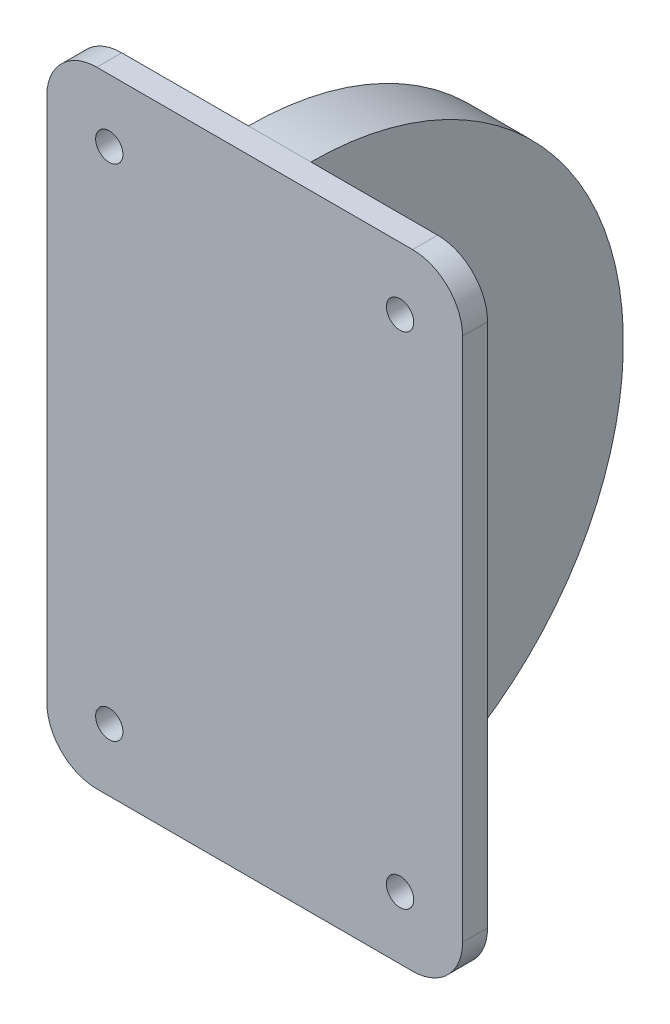
from build123d import *

# Parameters (mm, degrees)
SKETCH1_W           = 33.263379
SKETCH1_H           = 50
BOSS_EXTRUDE1_DEPTH = 2
FILLET1_R           = 4
SKETCH2_R           = 1.0922
CUT_EXTRUDE1_DEPTH  = 2
BOSS_EXTRUDE2_DEPTH = 2.5
SKETCH6_R           = 2.5
CUT_EXTRUDE2_DEPTH  = 5


with BuildPart() as part:
    # Sketch1 → Boss-Extrude1 (new body)
    with BuildSketch(Plane.XY):
        Rectangle(SKETCH1_W, SKETCH1_H)
    extrude(amount=BOSS_EXTRUDE1_DEPTH)

    # Fillet1
    fillet1_edges = [part.edges().sort_by_distance(p)[0] for p in [
        (-16.6316895, -25, 1),
        (16.6316895, -25, 1),
        (-16.6316895, 25, 1),
        (16.6316895, 25, 1),
    ]]
    fillet(fillet1_edges, radius=FILLET1_R)

    # Sketch2 → Cut-Extrude1 (cut)
    with BuildSketch(Plane.XY.offset(2)):
        with Locations((-11.6316895, 20)):
            Circle(SKETCH2_R)
        with Locations((11.6316895, 20)):
            Circle(SKETCH2_R)
        with Locations((-11.6316895, -20)):
            Circle(SKETCH2_R)
        with Locations((11.6316895, -20)):
            Circle(SKETCH2_R)
    extrude(amount=-CUT_EXTRUDE1_DEPTH, mode=Mode.SUBTRACT)

    # Sketch5 → Boss-Extrude2 (add, symmetric)
    with BuildSketch(Plane(origin=(0, 0, 0), x_dir=(0, 0, -1), z_dir=(1, 0, 0))):
        with BuildLine():
            Line((0, 25), (0, -25))
            ThreePointArc((0, -25), (25, 0), (0, 25))
        make_face()
    extrude(amount=BOSS_EXTRUDE2_DEPTH, both=True)

    # Sketch6 → Cut-Extrude2 (cut)
    with BuildSketch(Plane(origin=(2.5, 0, 0), x_dir=(0, 0, -1), z_dir=(1, 0, 0))):
        with Locations((10.61, 0)):
            Circle(SKETCH6_R)
    extrude(amount=-CUT_EXTRUDE2_DEPTH, mode=Mode.SUBTRACT)


solid = part.part
